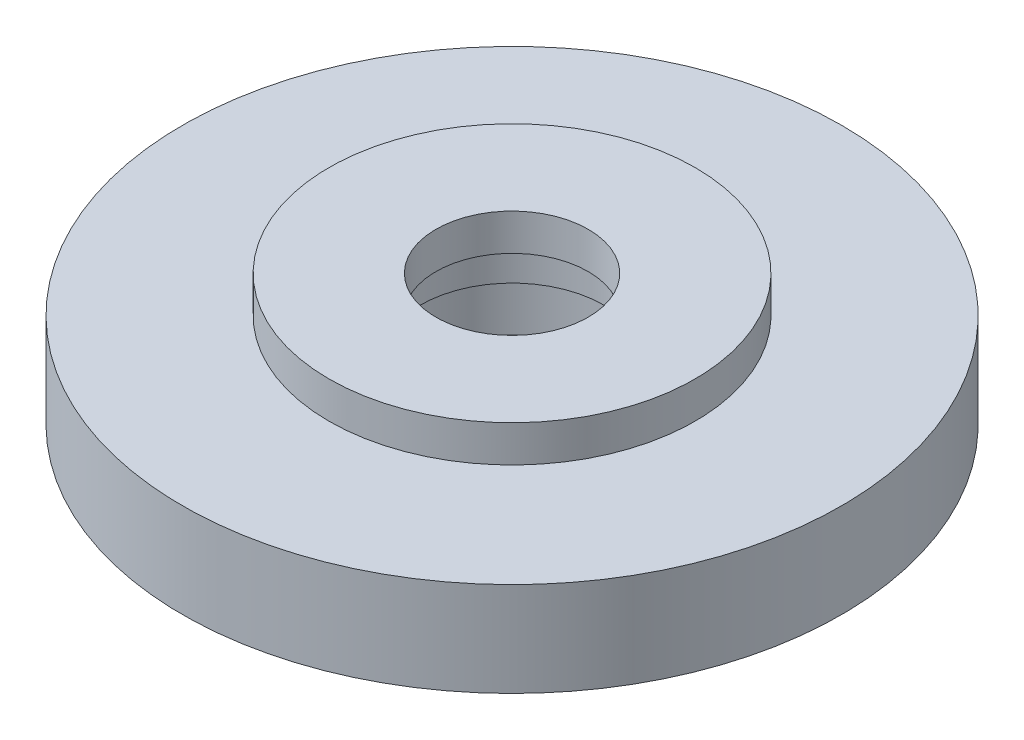
from build123d import *


with BuildPart() as part:
    # Sketch1 → Revolve1 (revolve)
    with BuildSketch(Plane.XY):
        Polygon((-15.875, 11.35), (-6.604, 11.35), (-6.604, 8.175), (-7.9375, 8.175), (-7.9375, 5), (-9.5, 5), (-9.5, 0), (-20.6375, 0), (-20.6375, 3.1369), (-25.4, 3.1369), (-25.4, 0), (-28.575, 0), (-28.575, 8.175), (-15.875, 8.175), align=None)
    revolve(axis=Axis((0, 0, 0), (0, 1, 0)))


solid = part.part
